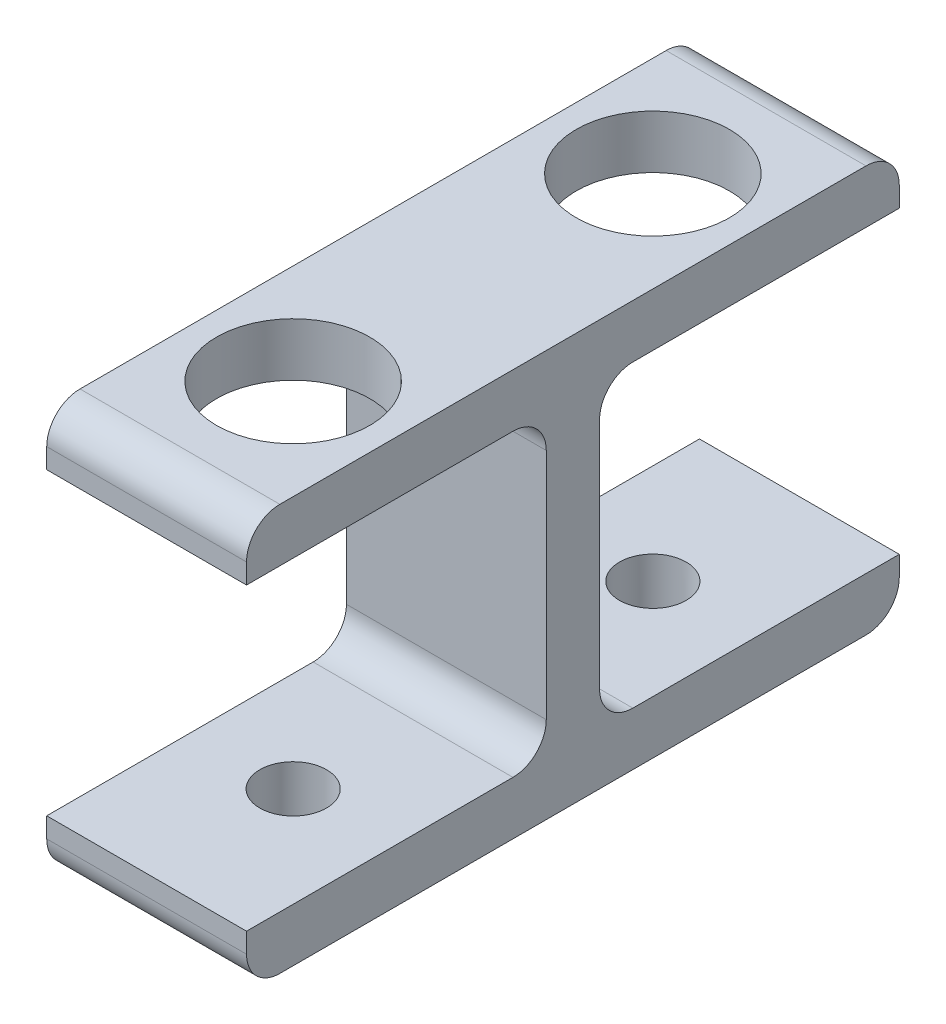
from build123d import *

# Parameters (mm, degrees)
BOSS_EXTRUDE1_DEPTH  = 30
CUT_EXTRUDE1_REACH   = 85.797
SKETCH2_R            = 11.5
CUT_EXTRUDE2_REACH   = 80.166
SKETCH3_R            = 5
FILLET2_R            = 5
FILLET2_OF_MIRROR2_R = 5
FILLET3_R            = 5


with BuildPart() as part:
    # Sketch1 → Boss-Extrude1 (new body)
    with BuildSketch(Plane(origin=(0, 0, 0), x_dir=(0, 0, -1), z_dir=(1, 0, 0))):
        Polygon((0, 0), (45, 0), (45, -45), (0, -45), (0, -53), (49, -53), (49, 8), (0, 8), align=None)
    boss_extrude1 = extrude(amount=BOSS_EXTRUDE1_DEPTH)

    # Sketch2 → Cut-Extrude1 (cut, up to next)
    with BuildSketch(Plane(origin=(0, 8, 0), x_dir=(1, 0, 0), z_dir=(0, 1, 0)), mode=Mode.PRIVATE) as cut_extrude1_sk1:
        with Locations((15, 22)):
            Circle(SKETCH2_R)
    cut_extrude1_tool1 = extrude(cut_extrude1_sk1.sketch, amount=-CUT_EXTRUDE1_REACH, mode=Mode.PRIVATE) & part.part
    cut_extrude1 = cut_extrude1_tool1.solids().sort_by_distance((15, 8, -22))[0]
    add(cut_extrude1, mode=Mode.SUBTRACT)

    # Sketch3 → Cut-Extrude2 (cut, up to next)
    with BuildSketch(Plane(origin=(0, -45, 0), x_dir=(1, 0, 0), z_dir=(0, 1, 0)), mode=Mode.PRIVATE) as cut_extrude2_sk1:
        with Locations((15, 22)):
            Circle(SKETCH3_R)
    cut_extrude2_tool1 = extrude(cut_extrude2_sk1.sketch, amount=-CUT_EXTRUDE2_REACH, mode=Mode.PRIVATE) & part.part
    cut_extrude2 = cut_extrude2_tool1.solids().sort_by_distance((15, -45, -22))[0]
    add(cut_extrude2, mode=Mode.SUBTRACT)

    # Fillet2
    fillet2_edges = [part.edges().sort_by_distance(p)[0] for p in [
        (15, 0, -45),
        (15, -45, -45),
    ]]
    fillet(fillet2_edges, radius=FILLET2_R)

    # Mirror2: Boss-Extrude1, Cut-Extrude1, Cut-Extrude2 across plane
    add(boss_extrude1.mirror(Plane(origin=(30, -53, -49), x_dir=(1, 0, 0), z_dir=(0, 0, 1))))
    add(cut_extrude1.mirror(Plane(origin=(30, -53, -49), x_dir=(1, 0, 0), z_dir=(0, 0, 1))), mode=Mode.SUBTRACT)
    add(cut_extrude2.mirror(Plane(origin=(30, -53, -49), x_dir=(1, 0, 0), z_dir=(0, 0, 1))), mode=Mode.SUBTRACT)

    # Fillet2 of Mirror2
    fillet2_of_mirror2_edges = [part.edges().sort_by_distance(p)[0] for p in [
        (15, 0, -53),
        (15, -45, -53),
    ]]
    fillet(fillet2_of_mirror2_edges, radius=FILLET2_OF_MIRROR2_R)

    # Fillet3
    fillet3_edges = [part.edges().sort_by_distance(p)[0] for p in [
        (15, -53, -98),
        (15, 8, -98),
        (15, -53, 0),
        (15, 8, 0),
    ]]
    fillet(fillet3_edges, radius=FILLET3_R)


solid = part.part
